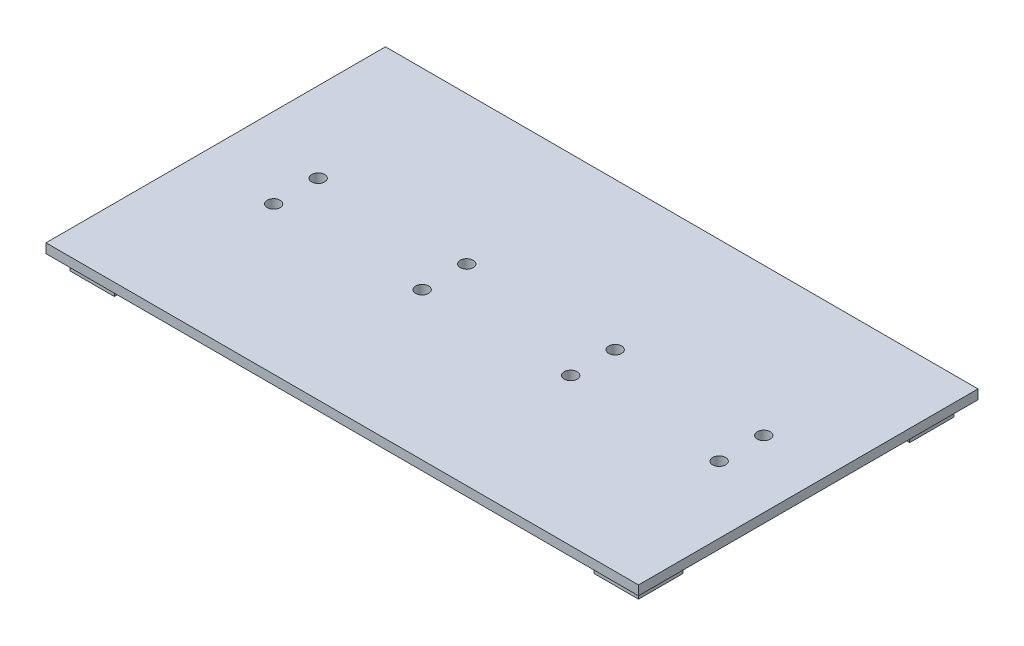
from build123d import *

# Parameters (mm, degrees)
SKETCH1_W                             = 399
SKETCH1_H                             = 228.6
BASE_DEPTH                            = 6.35
HOLE_FOR_1_4_BLIND_FASTENERS_B_BS_1_D = 8.7376
SKETCH12_W                            = 30
SKETCH12_H                            = 30
BOSS_EXTRUDE1_DEPTH                   = 10


with BuildPart() as part:
    # Sketch1 → Base (new body)
    with BuildSketch(Plane(origin=(0, 0, 0), x_dir=(1, 0, 0), z_dir=(0, 1, 0))):
        with Locations((199.5, -114.3)):
            Rectangle(SKETCH1_W, SKETCH1_H)
    extrude(amount=-BASE_DEPTH)

    # Hole for 1/4 Blind Fasteners (B,BS)1 (through all)
    with Locations(Plane(origin=(0, 0, 0), x_dir=(1, 0, 0), z_dir=(0, 1, 0))):
        with Locations((354, -129.3), (254, -129.3), (154, -129.3), (54, -129.3), (54, -99.3), (154, -99.3), (254, -99.3), (354, -99.3)):
            Hole(HOLE_FOR_1_4_BLIND_FASTENERS_B_BS_1_D / 2)

    # Sketch12 → Boss-Extrude1 (add)
    with BuildSketch(Plane.XZ.offset(6.35)):
        with Locations((23, 205.6)):
            Rectangle(SKETCH12_W, SKETCH12_H)
        with Locations((23, 23)):
            Rectangle(SKETCH12_W, SKETCH12_H)
        with Locations((376, 23)):
            Rectangle(SKETCH12_W, SKETCH12_H)
        with Locations((376, 205.6)):
            Rectangle(SKETCH12_W, SKETCH12_H)
    extrude(amount=BOSS_EXTRUDE1_DEPTH)


solid = part.part
